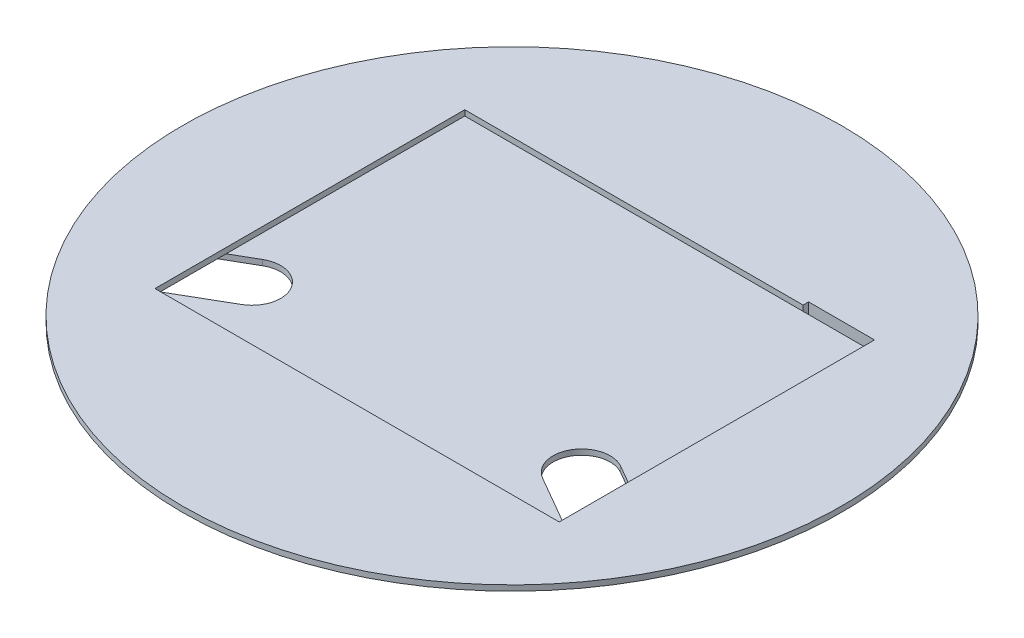
from build123d import *

# Parameters (mm, degrees)
SKETCH1_R           = 150
BOSS_EXTRUDE1_DEPTH = 5
SKETCH4_W           = 184
SKETCH4_H           = 141
CUT_EXTRUDE2_DEPTH  = 2.5
SKETCH6_R           = 150
CUT_EXTRUDE3_DEPTH  = 2.5
SKETCH9_W           = 30
SKETCH9_H           = 2.5
CUT_EXTRUDE10_DEPTH = 2.5
SKETCH10_W          = 30
SKETCH10_H          = 2.5
CUT_EXTRUDE11_DEPTH = 2.5


with BuildPart() as part:
    # Sketch1 → Boss-Extrude1 (new body)
    with BuildSketch(Plane(origin=(0, 0, 0), x_dir=(1, 0, 0), z_dir=(0, 1, 0))):
        Circle(SKETCH1_R)
    extrude(amount=BOSS_EXTRUDE1_DEPTH)

    # Sketch4 → Cut-Extrude2 (cut)
    with BuildSketch(Plane(origin=(0, 5, 0), x_dir=(1, 0, 0), z_dir=(0, 1, 0))):
        Rectangle(SKETCH4_W, SKETCH4_H)
    extrude(amount=-CUT_EXTRUDE2_DEPTH, mode=Mode.SUBTRACT)

    # Sketch6 → Cut-Extrude3 (cut)
    with BuildSketch(Plane(origin=(0, 0, 0), x_dir=(-1, 0, 0), z_dir=(0, -1, 0))):
        Circle(SKETCH6_R)
        with BuildLine():
            Line((-12.999999814, 86.600338592), (-13.005439365, 118.717060932))
            ThreePointArc((-13.005439365, 118.717060932), (-14.564983201, 122.122721815), (-18.161893274, 123.168159979))
            ThreePointArc((-18.161893274, 123.168159979), (-107.820162771, 62.25), (-115.747702116, -45.855419034))
            ThreePointArc((-115.747702116, -45.855419034), (-113.043871072, -48.44771545), (-109.314710312, -48.095489589))
            Line((-109.314710312, -48.095489589), (-81.498093104, -32.041839208))
            ThreePointArc((-81.498093104, -32.041839208), (-63.741669751, -36.801270189), (-68.49809329, -54.558499384))
            Line((-68.49809329, -54.558499384), (-96.309270948, -70.621571343))
            ThreePointArc((-96.309270948, -70.621571343), (-98.478887871, -73.675006365), (-97.585808843, -77.312740946))
            ThreePointArc((-97.585808843, -77.312740946), (0, -124.5), (97.585808843, -77.312740946))
            ThreePointArc((97.585808843, -77.312740946), (98.478887871, -73.675006365), (96.309270948, -70.621571343))
            Line((96.309270948, -70.621571343), (68.49809329, -54.558499384))
            ThreePointArc((68.49809329, -54.558499384), (63.741669751, -36.801270189), (81.498093104, -32.041839208))
            Line((81.498093104, -32.041839208), (109.314710312, -48.095489589))
            ThreePointArc((109.314710312, -48.095489589), (113.043871072, -48.44771545), (115.747702116, -45.855419034))
            ThreePointArc((115.747702116, -45.855419034), (107.820162771, 62.25), (18.161893274, 123.168159979))
            ThreePointArc((18.161893274, 123.168159979), (14.564983201, 122.122721815), (13.005439365, 118.717060932))
            Line((13.005439365, 118.717060932), (12.999999814, 86.600338592))
            ThreePointArc((12.999999814, 86.600338592), (0, 73.602540378), (-12.999999814, 86.600338592))
        make_face(mode=Mode.SUBTRACT)
    extrude(amount=-CUT_EXTRUDE3_DEPTH, mode=Mode.SUBTRACT)

    # Sketch9 → Cut-Extrude10 (cut)
    with BuildSketch(Plane(origin=(0, 5, 0), x_dir=(1, 0, 0), z_dir=(0, 1, 0))):
        with Locations((77, 71.75)):
            Rectangle(SKETCH9_W, SKETCH9_H)
    extrude(amount=-CUT_EXTRUDE10_DEPTH, mode=Mode.SUBTRACT)

    # Sketch10 → Cut-Extrude11 (cut)
    with BuildSketch(Plane.XZ):
        with Locations((77, -71.75)):
            Rectangle(SKETCH10_W, SKETCH10_H)
    extrude(amount=-CUT_EXTRUDE11_DEPTH, mode=Mode.SUBTRACT)


solid = part.part
